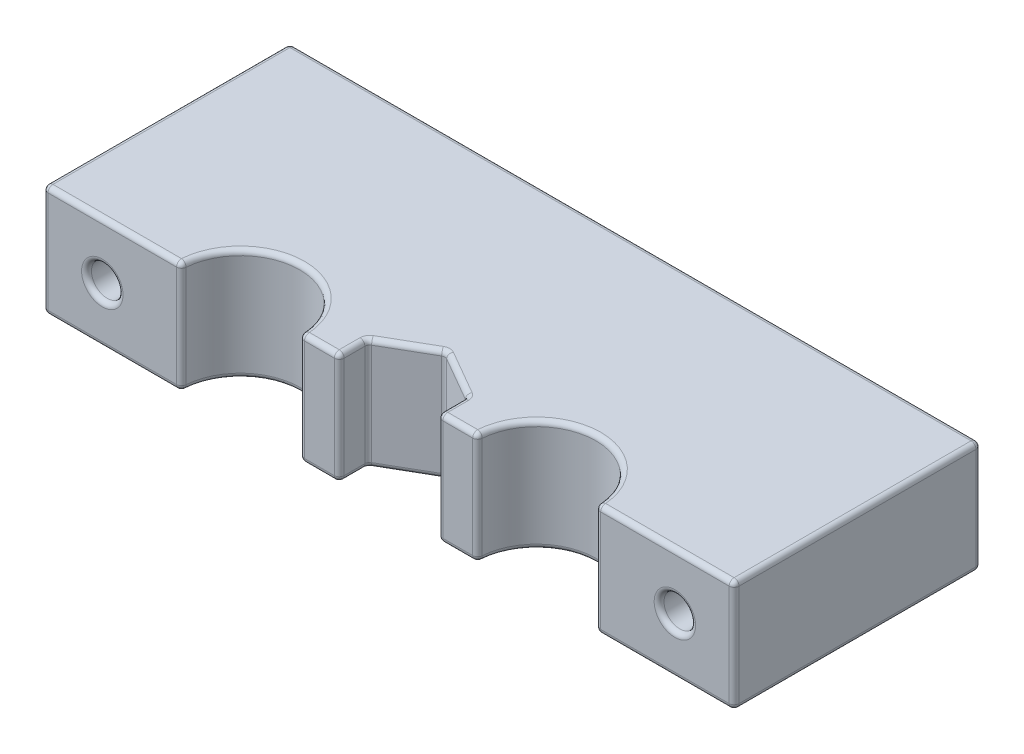
from build123d import *

# Parameters (mm, degrees)
BOSS_EXTRUDE1_DEPTH = 11.3
SKETCH2_R           = 1.6
CUT_EXTRUDE1_DEPTH  = 76.184373376
FILLET1_R           = 0.5


with BuildPart() as part:
    # Sketch1 → Boss-Extrude1 (new body)
    with BuildSketch(Plane(origin=(0, 0, 0), x_dir=(1, 0, 0), z_dir=(0, 1, 0))):
        with BuildLine():
            Line((56, 0), (70, 0))
            Line((70, 0), (70, 25))
            Line((70, 25), (0, 25))
            Line((0, 25), (0, 0))
            Line((0, 0), (14, 0))
            ThreePointArc((14, 0), (20, 6), (26, 0))
            Line((26, 0), (30, 0))
            Line((30, 0), (30, 2.886751346))
            Line((30, 2.886751346), (35, 5.773502692))
            Line((35, 5.773502692), (40, 2.886751346))
            Line((40, 2.886751346), (40, 0))
            Line((40, 0), (44, 0))
            ThreePointArc((44, 0), (50, 6), (56, 0))
        make_face()
    extrude(amount=BOSS_EXTRUDE1_DEPTH)

    # Sketch2 → Cut-Extrude1 (cut, through all)
    with BuildSketch(Plane(origin=(0, 0, -25), x_dir=(-1, 0, 0), z_dir=(0, 0, -1))):
        with Locations((-6, 5.65)):
            Circle(SKETCH2_R)
        with Locations((-64, 5.65)):
            Circle(SKETCH2_R)
    extrude(amount=-CUT_EXTRUDE1_DEPTH, mode=Mode.SUBTRACT)

    # Fillet1
    fillet1_edges = [part.edges().sort_by_distance(p)[0] for p in [
        (30, 5.65, 0),
        (30, 5.65, -2.886751346),
        (35, 5.65, -5.773502692),
        (40, 5.65, -2.886751346),
        (65.6, 5.65, 0),
        (7.6, 5.65, 0),
        (14, 5.65, 0),
        (26, 5.65, 0),
        (44, 5.65, 0),
        (56, 5.65, 0),
        (70, 5.65, 0),
        (0, 5.65, 0),
        (70, 5.65, -25),
        (0, 5.65, -25),
        (65.6, 5.65, -25),
        (7.6, 5.65, -25),
        (20, 0, -6),
        (28, 0, 0),
        (30, 0, -1.443375673),
        (32.5, 0, -4.330127019),
        (37.5, 0, -4.330127019),
        (40, 0, -1.443375673),
        (42, 0, 0),
        (50, 0, -6),
        (63, 0, 0),
        (70, 0, -12.5),
        (35, 0, -25),
        (0, 0, -12.5),
        (7, 0, 0),
        (0, 11.3, -12.5),
        (35, 11.3, -25),
        (70, 11.3, -12.5),
        (63, 11.3, 0),
        (50, 11.3, -6),
        (42, 11.3, 0),
        (40, 11.3, -1.443375673),
        (37.5, 11.3, -4.330127019),
        (32.5, 11.3, -4.330127019),
        (30, 11.3, -1.443375673),
        (28, 11.3, 0),
        (20, 11.3, -6),
        (7, 11.3, 0),
        (40, 5.65, 0),
    ]]
    fillet(fillet1_edges, radius=FILLET1_R)


solid = part.part
